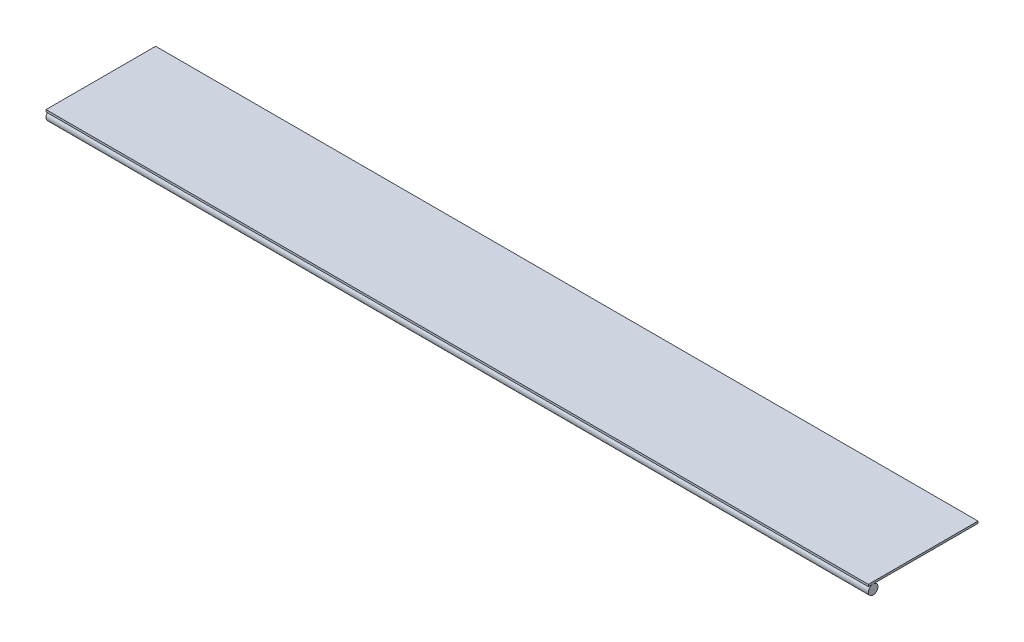
from build123d import *

# Parameters (mm, degrees)
SKETCH1_W           = 300
SKETCH1_H           = 40
BASE_FLANGE1_DEPTH  = 0.75
SKETCH6_R           = 1.76
BOSS_EXTRUDE1_DEPTH = 300


# Sheet-metal steps are written as plain solids
with BuildPart() as part:
    # Sketch1 → Base-Flange1 (new body)
    with BuildSketch(Plane(origin=(0, 0, 0), x_dir=(1, 0, 0), z_dir=(0, 1, 0))):
        Rectangle(SKETCH1_W, SKETCH1_H)
    extrude(amount=BASE_FLANGE1_DEPTH)


with BuildPart() as body_2:
    # Sketch6 → Boss-Extrude1 (new body)
    with BuildSketch(Plane(origin=(150, 0, 0), x_dir=(0, 0, -1), z_dir=(1, 0, 0))):
        with Locations((-18.24, -1.76)):
            Circle(SKETCH6_R)
    extrude(amount=-BOSS_EXTRUDE1_DEPTH)


solid = Compound([part.part, body_2.part])
